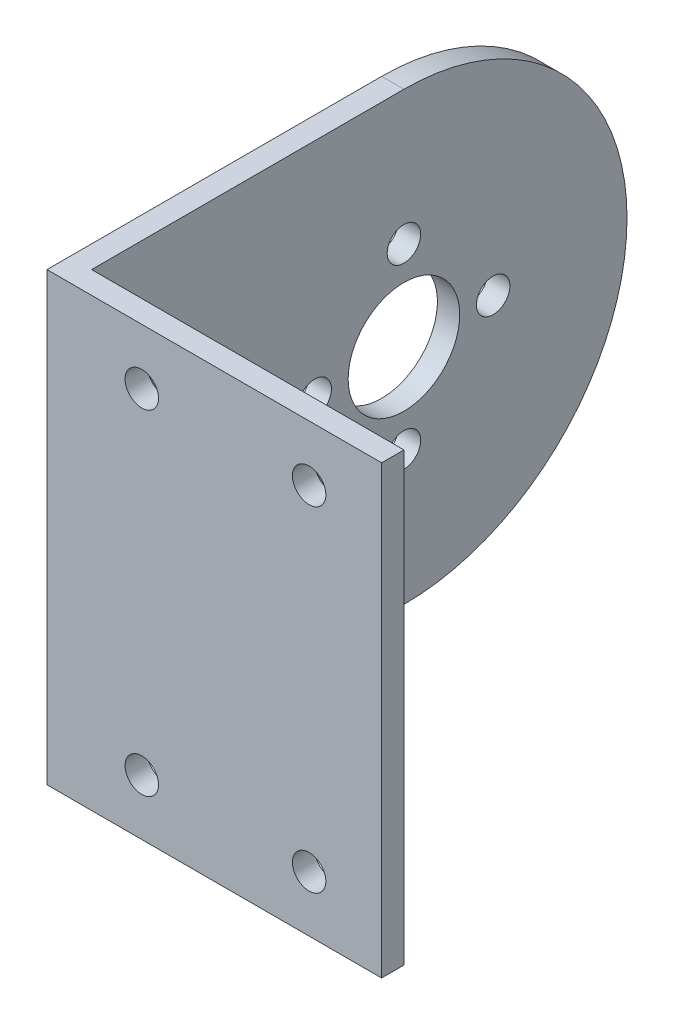
from build123d import *

# Parameters (mm, degrees)
EXTRUDE_1_DEPTH     = 40
FILLET_1_R          = 20
SKETCH_3_R          = 5
CUT_EXTRUDE_1_DEPTH = 10
SKETCH_15_R         = 1.5
CUT_EXTRUDE_2_DEPTH = 10
SKETCH_18_R         = 1.5
CUT_EXTRUDE_5_DEPTH = 10


with BuildPart() as part:
    # 草图1 → 凸台-拉伸1 (new body)
    with BuildSketch(Plane(origin=(0, 0, 0), x_dir=(1, 0, 0), z_dir=(0, 1, 0))):
        Polygon((-2.488479263, -6.032258065), (-32.488479263, -6.032258065), (-32.488479263, 43.967741935), (-30.488479263, 43.967741935), (-30.488479263, -4.032258065), (-2.488479263, -4.032258065), align=None)
    extrude(amount=EXTRUDE_1_DEPTH)

    # 圆角1
    fillet_1_edges = [part.edges().sort_by_distance(p)[0] for p in [
        (-31.488479263, 40, -43.967741935),
        (-31.488479263, 0, -43.967741935),
    ]]
    fillet(fillet_1_edges, radius=FILLET_1_R - 0.0001)  # a hair under: the kernel refuses the full size

    # 草图3 → 切除-拉伸1 (cut)
    with BuildSketch(Plane.ZY.offset(32.488479263)):
        with Locations((-23.967741935, 20)):
            Circle(SKETCH_3_R)
    extrude(amount=-CUT_EXTRUDE_1_DEPTH, mode=Mode.SUBTRACT)

    # 草图15 → 切除-拉伸2 (cut)
    with BuildSketch(Plane(origin=(-32.488479263, 20.448882386, -1043.967741935), x_dir=(0, 0, 1), z_dir=(-1, 0, 0))):
        with Locations((1012, -0.448882386)):
            Circle(SKETCH_15_R)
        with Locations((1020, 7.551117614)):
            Circle(SKETCH_15_R)
        with Locations((1028, -0.448882386)):
            Circle(SKETCH_15_R)
        with Locations((1020, -8.448882386)):
            Circle(SKETCH_15_R)
    extrude(amount=-CUT_EXTRUDE_2_DEPTH, mode=Mode.SUBTRACT)

    # 草图18 → 切除-拉伸5 (cut)
    with BuildSketch(Plane(origin=(0, 0, 4.032258065), x_dir=(-1, 0, 0), z_dir=(0, 0, -1))):
        with Locations((8.988479263, 35)):
            Circle(SKETCH_18_R)
        with Locations((23.988479263, 35)):
            Circle(SKETCH_18_R)
        with Locations((23.988479263, 5)):
            Circle(SKETCH_18_R)
        with Locations((8.988479263, 5)):
            Circle(SKETCH_18_R)
    extrude(amount=-CUT_EXTRUDE_5_DEPTH, mode=Mode.SUBTRACT)


solid = part.part
